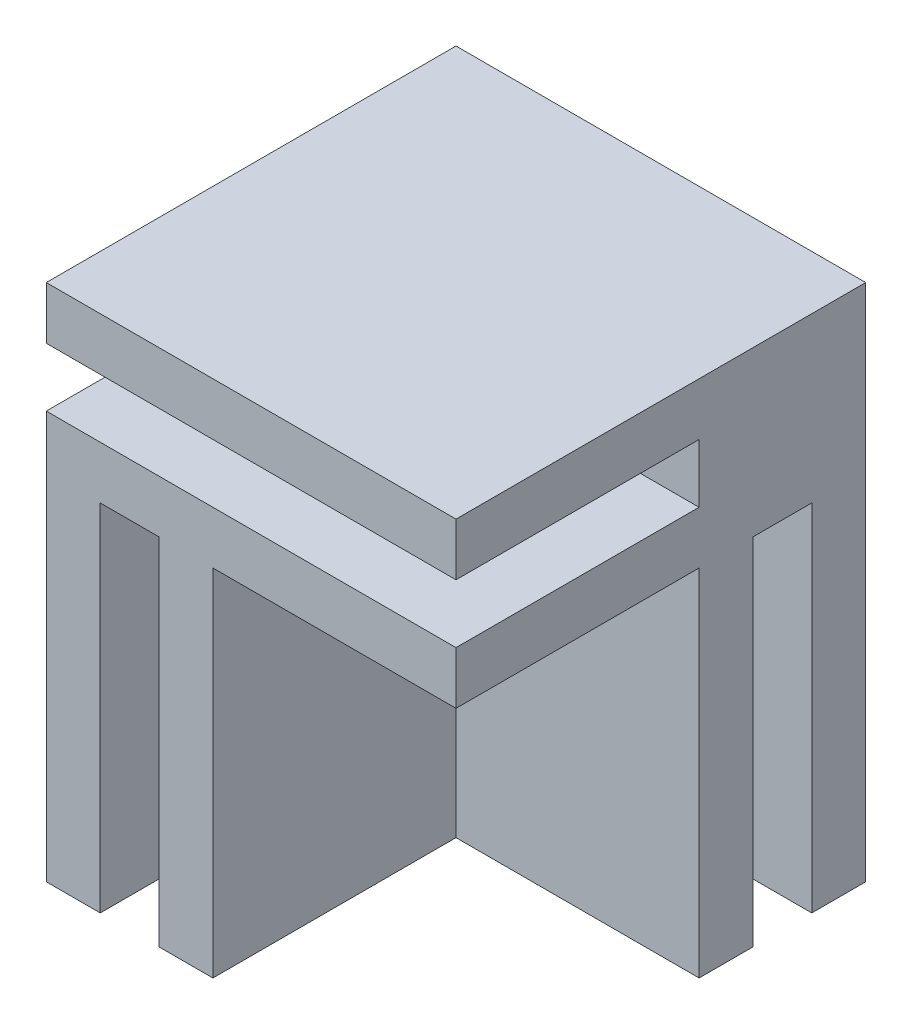
from build123d import *

# Parameters (mm, degrees)
ESQUISSE1_W             = 30
ESQUISSE1_H             = 30
BOSS_EXTRU_1_DEPTH      = 38
ESQUISSE2_W             = 17.8
ESQUISSE2_H             = 4.3
ESQUISSE2_W_2           = 4.3
ESQUISSE2_H_2           = 17.8
ENL_V_MAT_EXTRU_1_DEPTH = 26
ESQUISSE5_W             = 17.8
ESQUISSE5_H             = 4.3
ENL_V_MAT_EXTRU_4_DEPTH = 52.13914869


with BuildPart() as part:
    # Esquisse1 → Boss.-Extru.1 (new body)
    with BuildSketch(Plane(origin=(0, 0, 0), x_dir=(1, 0, 0), z_dir=(0, 1, 0))):
        with Locations((-20.886738322, -1.468531469)):
            Rectangle(ESQUISSE1_W, ESQUISSE1_H)
    extrude(amount=BOSS_EXTRU_1_DEPTH)

    # Esquisse2 → Enlèv. mat.-Extru.1 (cut)
    with BuildSketch(Plane.XZ):
        with Locations((-14.786738322, -7.431468531)):
            Rectangle(ESQUISSE2_W, ESQUISSE2_H)
        with Locations((-29.786738322, 7.568531469)):
            Rectangle(ESQUISSE2_W_2, ESQUISSE2_H_2)
        with Locations((-14.786738322, 7.568531469)):
            Rectangle(ESQUISSE2_W, ESQUISSE2_H_2)
    extrude(amount=-ENL_V_MAT_EXTRU_1_DEPTH, mode=Mode.SUBTRACT)

    # Esquisse5 → Enlèv. mat.-Extru.4 (cut, through all)
    with BuildSketch(Plane.ZY.offset(35.886738322)):
        with Locations((7.568531469, 32)):
            Rectangle(ESQUISSE5_W, ESQUISSE5_H)
    extrude(amount=-ENL_V_MAT_EXTRU_4_DEPTH, mode=Mode.SUBTRACT)


solid = part.part
